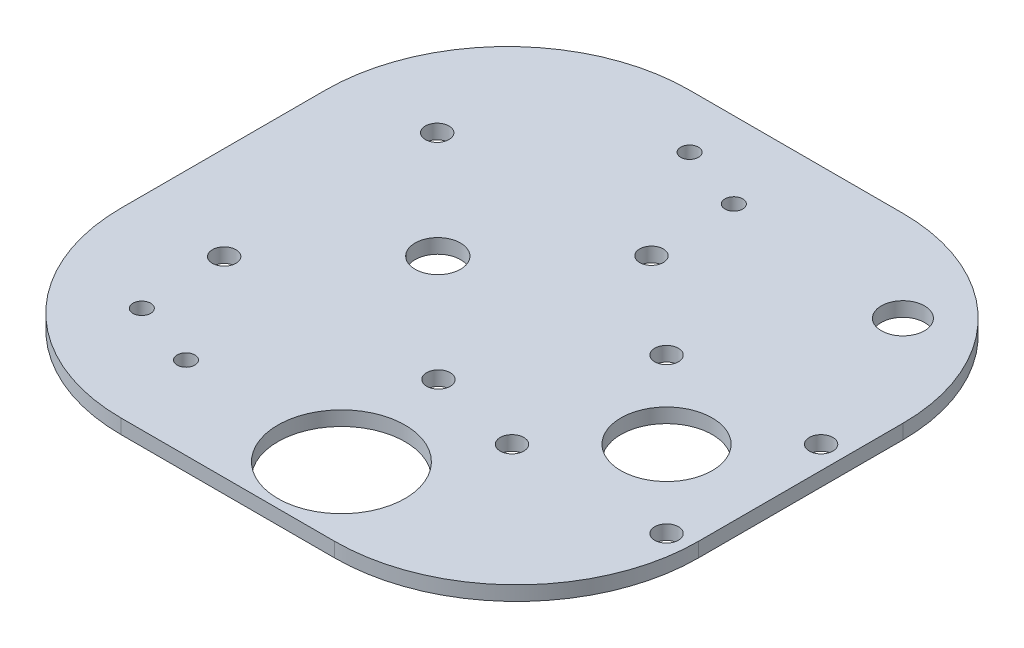
from build123d import *

# Parameters (mm, degrees)
CROQUIS1_W                     = 127
CROQUIS1_H                     = 125
BRIDA_BASE1_DEPTH              = 3.175
CROQUIS11_R                    = 10.05
CORTAR_EXTRUIR3_DEPTH          = 10
TALADRO_DE_MARGEN_PARA_M51_D   = 5.2
TALADRO_DE_MARGEN_PARA_M52_D   = 5.2
CROQUIS16_R                    = 5
CORTAR_EXTRUIR4_DEPTH          = 127.234229213
CROQUIS17_R                    = 14
CROQUIS17_R_2                  = 4.75
CORTAR_EXTRUIR5_DEPTH          = 10
TALADRO_DE_MARGEN_PARA_M3_51_D = 3.9
REDONDEO1_R                    = 40


# Sheet-metal steps are written as plain solids
with BuildPart() as part:
    # Croquis1 → Brida base1 (new body)
    with BuildSketch(Plane(origin=(0, 0, 0), x_dir=(1, 0, 0), z_dir=(0, 1, 0))):
        with Locations((-41.5, 7.5)):
            Rectangle(CROQUIS1_W, CROQUIS1_H)
    extrude(amount=-BRIDA_BASE1_DEPTH)

    # Croquis11 → Cortar-Extruir3 (cut)
    with BuildSketch(Plane(origin=(0, 0, 0), x_dir=(1, 0, 0), z_dir=(0, 1, 0))):
        with Locations(Location((0, 0, 0), (0, 0, 270))):
            Circle(CROQUIS11_R)
    extrude(amount=-CORTAR_EXTRUIR3_DEPTH, mode=Mode.SUBTRACT)

    # Taladro de margen para M51 (through all)
    with Locations(Plane(origin=(0, 0, 0), x_dir=(1, 0, 0), z_dir=(0, 1, 0))):
        with Locations((17, 17), (-17, 17), (-17, -17), (17, -17)):
            Hole(TALADRO_DE_MARGEN_PARA_M51_D / 2)

    # Taladro de margen para M52 (through all)
    with Locations(Plane(origin=(0, 0, 0), x_dir=(1, 0, 0), z_dir=(0, 1, 0))):
        with Locations((-37.578650523, 34.25587131), (-37.434837835, -12.743908668), (-84.434617812, -12.887721356), (-84.578430501, 34.112058621), (-61.006634168, 10.684074977)):
            Hole(TALADRO_DE_MARGEN_PARA_M52_D / 2)

    # Croquis16 → Cortar-Extruir4 (cut, through all)
    with BuildSketch(Plane(origin=(0, 0, 0), x_dir=(1, 0, 0), z_dir=(0, 1, 0))):
        with Locations(Location((-61.006634168, 10.684074977, 0), (0, 0, 270))):
            Circle(CROQUIS16_R)
    extrude(amount=-CORTAR_EXTRUIR4_DEPTH, mode=Mode.SUBTRACT)

    # Croquis17 → Cortar-Extruir5 (cut)
    with BuildSketch(Plane(origin=(0, 0, 0), x_dir=(1, 0, 0), z_dir=(0, 1, 0))):
        with Locations(Location((-32.425079896, -39.098203149, 0), (0, 0, 270))):
            Circle(CROQUIS17_R)
        with Locations(Location((2, 50, 0), (0, 0, 270))):
            Circle(CROQUIS17_R_2)
    extrude(amount=-CORTAR_EXTRUIR5_DEPTH, mode=Mode.SUBTRACT)

    # Taladro de margen para M3.51 (through all)
    with Locations(Plane(origin=(-235.296017462, -6.288, -137.590485756), x_dir=(-0.5911403395410236, 0, 0.806568719308729), z_dir=(0, -1, 0))):
        with Locations((46.983235392, -222.472189169), (42.30898943, -237.296741799), (-48.324723402, -208.719537692), (-43.650477439, -193.894985062)):
            Hole(TALADRO_DE_MARGEN_PARA_M3_51_D / 2)

    # Redondeo1
    redondeo1_edges = [part.edges().sort_by_distance(p)[0] for p in [
        (22, -1.5875, 55),
        (-105, -1.5875, 55),
        (-105, -1.5875, -70),
        (22, -1.5875, -70),
    ]]
    fillet(redondeo1_edges, radius=REDONDEO1_R)


solid = part.part
